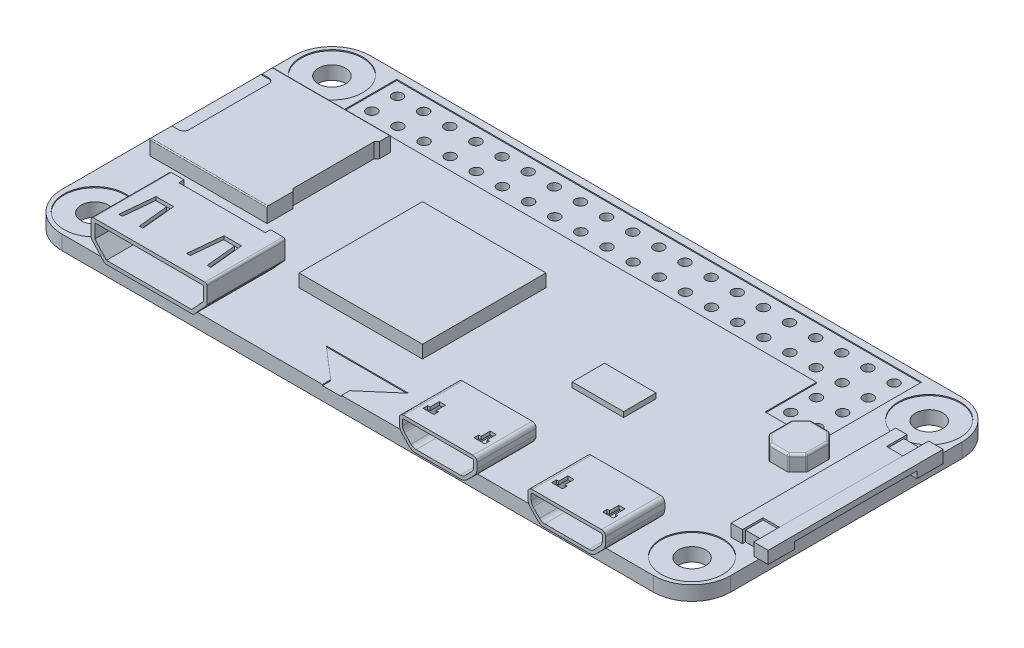
from build123d import *

# Parameters (mm, degrees)
BOSS_EXTRUDE1_DEPTH      = 1.4
SKETCH2_R                = 1.325
CUT_EXTRUDE1_DEPTH       = 36.821920663
SKETCH3_R                = 0.5
CUT_EXTRUDE2_DEPTH       = 36.821920663
LPATTERN1_COUNT          = 20
LPATTERN1_PITCH          = 2.54
SKETCH5_R                = 0.5
CUT_EXTRUDE4_DEPTH       = 36.821920663
SKETCH4_R                = 3
CUT_EXTRUDE3_DEPTH       = 0.1
SKETCH6_W                = 12
SKETCH6_H                = 12
BOSS_EXTRUDE2_DEPTH      = 1.25
BOSS_EXTRUDE3_DEPTH      = 1.45
FILLET2_R                = 0.1
CUT_EXTRUDE5_DEPTH       = 65.240816464
CUT_EXTRUDE5_DEPTH_BACK  = 9.5
SKETCH8_W                = 11.8
SKETCH8_H                = 1.25
BOSS_EXTRUDE4_DEPTH      = 0.4
BOSS_EXTRUDE4_DEPTH_BACK = 7.2
FILLET1_R                = 0.2
CUT_EXTRUDE6_DEPTH       = 7
SKETCH11_W               = 7
SKETCH11_H               = 0.55
BOSS_EXTRUDE5_DEPTH      = 3.5
CUT_EXTRUDE7_DEPTH       = 37.226130072
SKETCH13_W               = 8.4
SKETCH13_H               = 1.4
CUT_EXTRUDE8_DEPTH       = 0.5
BOSS_EXTRUDE6_DEPTH      = 1.25
BOSS_EXTRUDE6_DEPTH_BACK = 4.5
CUT_EXTRUDE9_DEPTH       = 5.25
SKETCH17_W               = 3.15
SKETCH17_H               = 0.4
BOSS_EXTRUDE7_DEPTH      = 3.5
CUT_EXTRUDE10_DEPTH      = 0.32
BOSS_EXTRUDE8_DEPTH      = 0.9
BOSS_EXTRUDE8_DEPTH_BACK = 0.5
BOSS_EXTRUDE9_DEPTH      = 1.19
SKETCH21_W               = 1.6
SKETCH21_H               = 1.7
BOSS_EXTRUDE10_DEPTH     = 1
SKETCH22_W               = 3.65
SKETCH22_H               = 4
BOSS_EXTRUDE11_DEPTH     = 1.5
CHAMFER1_SIZE            = 0.9
SKETCH23_W               = 5
SKETCH23_H               = 3.15
BOSS_EXTRUDE12_DEPTH     = 0.5
FILLET3_R                = 0.2


with BuildPart() as part:
    # Sketch1 → Boss-Extrude1 (new body)
    with BuildSketch(Plane(origin=(0, 0, 0), x_dir=(1, 0, 0), z_dir=(0, 1, 0))):
        with BuildLine():
            Line((-28.75, 15), (28.75, 15))
            ThreePointArc((28.75, 15), (31.401650429, 13.901650429), (32.5, 11.25))
            Line((32.5, 11.25), (32.5, -11.25))
            ThreePointArc((32.5, -11.25), (31.401650429, -13.901650429), (28.75, -15))
            Line((28.75, -15), (-28.75, -15))
            ThreePointArc((-28.75, -15), (-31.401650429, -13.901650429), (-32.5, -11.25))
            Line((-32.5, -11.25), (-32.5, 11.25))
            ThreePointArc((-32.5, 11.25), (-31.401650429, 13.901650429), (-28.75, 15))
        make_face()
    extrude(amount=BOSS_EXTRUDE1_DEPTH)

    # Sketch2 → Cut-Extrude1 (cut, through all)
    with BuildSketch(Plane(origin=(0, 1.4, 0), x_dir=(1, 0, 0), z_dir=(0, 1, 0))):
        with Locations(Location((-29.025, 11.525, 0), (0, 0, 270))):
            Circle(SKETCH2_R)
        with Locations(Location((29.025, 11.525, 0), (0, 0, 90))):
            Circle(SKETCH2_R)
        with Locations(Location((29.025, -11.525, 0), (0, 0, 270))):
            Circle(SKETCH2_R)
        with Locations(Location((-29.025, -11.525, 0), (0, 0, 90))):
            Circle(SKETCH2_R)
    extrude(amount=-CUT_EXTRUDE1_DEPTH, mode=Mode.SUBTRACT)

    # Sketch3 → Cut-Extrude2 (cut, through all)
    with BuildSketch(Plane(origin=(0, 1.4, 0), x_dir=(1, 0, 0), z_dir=(0, 1, 0))):
        with Locations(Location((-24.128, 13, 0), (0, 0, 270))):
            Circle(SKETCH3_R)
        with Locations(Location((-24.128, 10.5, 0), (0, 0, 270))):
            Circle(SKETCH3_R)
    cut_extrude2 = extrude(amount=-CUT_EXTRUDE2_DEPTH, mode=Mode.SUBTRACT)

    # LPattern1: Cut-Extrude2 ×20
    with Locations(*[(i * LPATTERN1_PITCH, 0, 0) for i in range(1, LPATTERN1_COUNT)]):
        add(cut_extrude2, mode=Mode.SUBTRACT)

    # Sketch5 → Cut-Extrude4 (cut, through all)
    with BuildSketch(Plane(origin=(0, 1.4, 0), x_dir=(1, 0, 0), z_dir=(0, 1, 0))):
        with Locations(Location((21.592, 5.5, 0), (0, 0, 270))):
            Circle(SKETCH5_R)
        with Locations(Location((24.132, 5.5, 0), (0, 0, 270))):
            Circle(SKETCH5_R)
        with Locations(Location((21.592, 8, 0), (0, 0, 270))):
            Circle(SKETCH5_R)
        with Locations(Location((24.132, 8, 0), (0, 0, 270))):
            Circle(SKETCH5_R)
    extrude(amount=-CUT_EXTRUDE4_DEPTH, mode=Mode.SUBTRACT)

    # Sketch4 → Cut-Extrude3 (cut)
    with BuildSketch(Plane(origin=(0, 1.4, 0), x_dir=(1, 0, 0), z_dir=(0, 1, 0))):
        with Locations(Location((-29.025, 11.525, 0), (0, 0, 270))):
            Circle(SKETCH4_R)
        with Locations(Location((-29.025, -11.525, 0), (0, 0, 270))):
            Circle(SKETCH4_R)
        with Locations(Location((29.025, -11.525, 0), (0, 0, 270))):
            Circle(SKETCH4_R)
        with Locations(Location((29.025, 11.525, 0), (0, 0, 270))):
            Circle(SKETCH4_R)
        Polygon((-25.5, 14.3), (25.5, 14.3), (25.5, 9.2), (25.5, 4.2), (20.4, 4.2), (20.4, 9.2), (-25.5, 9.2), align=None)
        Polygon((-6.5, -11.55), (1.5, -11.55), (-1.575, -14.2), (-1.575, -15), (-3.425, -15), (-3.425, -14.2), align=None)
    extrude(amount=-CUT_EXTRUDE3_DEPTH, mode=Mode.SUBTRACT)

    # Sketch6 → Boss-Extrude2 (add)
    with BuildSketch(Plane(origin=(0, 1.4, 0), x_dir=(1, 0, 0), z_dir=(0, 1, 0))):
        with Locations((-6.7, -2)):
            Rectangle(SKETCH6_W, SKETCH6_H)
    extrude(amount=BOSS_EXTRUDE2_DEPTH)

    # Sketch7 → Boss-Extrude3 (add)
    with BuildSketch(Plane(origin=(0, 1.4, 0), x_dir=(1, 0, 0), z_dir=(0, 1, 0))):
        with BuildLine():
            Line((-19.65, 7.85), (-19.65, 6.75))
            Line((-19.65, 6.75), (-19.9, 6.5))
            Line((-19.9, 6.5), (-19.9, -1.4))
            Line((-19.9, -1.4), (-19.65, -1.65))
            Line((-19.65, -1.65), (-19.65, -4.15))
            Line((-19.65, -4.15), (-31.05, -4.15))
            Line((-31.05, -4.15), (-31.05, -2))
            Line((-31.05, -2), (-30.4, -2))
            ThreePointArc((-30.4, -2), (-30.046446609, -1.853553391), (-29.9, -1.5))
            Line((-29.9, -1.5), (-29.9, 6.25))
            ThreePointArc((-29.9, 6.25), (-30.046446609, 6.603553391), (-30.4, 6.75))
            Line((-30.4, 6.75), (-31.05, 6.75))
            Line((-31.05, 6.75), (-31.05, 7.85))
            Line((-31.05, 7.85), (-19.65, 7.85))
        make_face()
    extrude(amount=BOSS_EXTRUDE3_DEPTH)

    # Fillet2
    fillet2_edges = [part.edges().sort_by_distance(p)[0] for p in [
        (-25.35, 2.85, 4.15),
        (-25.35, 2.85, -7.85),
    ]]
    fillet(fillet2_edges, radius=FILLET2_R)

    # Sketch8 → Cut-Extrude5 (cut, two sides: drawn at the far end of the back side and taken through both)
    with BuildSketch(Plane.ZY.offset(29.9).offset(-CUT_EXTRUDE5_DEPTH_BACK)):
        with Locations((-1.85, 2.125)):
            Rectangle(SKETCH8_W, SKETCH8_H)
    extrude(amount=CUT_EXTRUDE5_DEPTH + CUT_EXTRUDE5_DEPTH_BACK, mode=Mode.SUBTRACT)

    # Sketch15 → Boss-Extrude6 (add, two sides: drawn at the far end of the back side and taken through both)
    with BuildSketch(Plane.XY.offset(15).offset(-BOSS_EXTRUDE6_DEPTH_BACK)):
        with BuildLine():
            Line((18.2, 4), (24.95, 4))
            ThreePointArc((24.95, 4), (25.232842712, 3.882842712), (25.35, 3.6))
            Line((25.35, 3.6), (25.35, 3.052310288))
            ThreePointArc((25.35, 3.052310288), (25.277735771, 2.679072643), (25.071387321, 2.359778459))
            Line((25.071387321, 2.359778459), (24.445169445, 1.707468172))
            ThreePointArc((24.445169445, 1.707468172), (24.115871509, 1.480072876), (23.723782124, 1.4))
            Line((23.723782124, 1.4), (19.426217876, 1.4))
            ThreePointArc((19.426217876, 1.4), (19.034128491, 1.480072876), (18.704830555, 1.707468172))
            Line((18.704830555, 1.707468172), (18.078612679, 2.359778459))
            ThreePointArc((18.078612679, 2.359778459), (17.872264229, 2.679072643), (17.8, 3.052310288))
            Line((17.8, 3.052310288), (17.8, 3.6))
            ThreePointArc((17.8, 3.6), (17.917157288, 3.882842712), (18.2, 4))
        make_face()
        with BuildLine():
            Line((12.85, 3.6), (12.85, 3.052310288))
            ThreePointArc((12.85, 3.052310288), (12.777735771, 2.679072643), (12.571387321, 2.359778459))
            Line((12.571387321, 2.359778459), (11.945169445, 1.707468172))
            ThreePointArc((11.945169445, 1.707468172), (11.615871509, 1.480072876), (11.223782124, 1.4))
            Line((11.223782124, 1.4), (6.926217876, 1.4))
            ThreePointArc((6.926217876, 1.4), (6.534128491, 1.480072876), (6.204830555, 1.707468172))
            Line((6.204830555, 1.707468172), (5.578612679, 2.359778459))
            ThreePointArc((5.578612679, 2.359778459), (5.372264229, 2.679072643), (5.3, 3.052310288))
            Line((5.3, 3.052310288), (5.3, 3.6))
            ThreePointArc((5.3, 3.6), (5.417157288, 3.882842712), (5.7, 4))
            Line((5.7, 4), (12.45, 4))
            ThreePointArc((12.45, 4), (12.732842712, 3.882842712), (12.85, 3.6))
        make_face()
    extrude(amount=BOSS_EXTRUDE6_DEPTH + BOSS_EXTRUDE6_DEPTH_BACK)

    # Sketch16 → Cut-Extrude9 (cut)
    with BuildSketch(Plane.XY.offset(16.25)):
        with BuildLine():
            Line((12.45, 3.68), (5.7, 3.68))
            ThreePointArc((5.7, 3.68), (5.643431458, 3.656568542), (5.62, 3.6))
            Line((5.62, 3.6), (5.62, 3.052310288))
            ThreePointArc((5.62, 3.052310288), (5.669139676, 2.798508689), (5.809456622, 2.581388644))
            Line((5.809456622, 2.581388644), (6.435674498, 1.929078357))
            ThreePointArc((6.435674498, 1.929078357), (6.659597094, 1.774449555), (6.926217876, 1.72))
            Line((6.926217876, 1.72), (11.223782124, 1.72))
            ThreePointArc((11.223782124, 1.72), (11.490402906, 1.774449555), (11.714325502, 1.929078357))
            Line((11.714325502, 1.929078357), (12.340543378, 2.581388644))
            ThreePointArc((12.340543378, 2.581388644), (12.480860324, 2.798508689), (12.53, 3.052310288))
            Line((12.53, 3.052310288), (12.53, 3.6))
            ThreePointArc((12.53, 3.6), (12.506568542, 3.656568542), (12.45, 3.68))
        make_face()
        with BuildLine():
            Line((24.214325502, 1.929078357), (24.840543378, 2.581388644))
            ThreePointArc((24.840543378, 2.581388644), (24.980860324, 2.798508689), (25.03, 3.052310288))
            Line((25.03, 3.052310288), (25.03, 3.6))
            ThreePointArc((25.03, 3.6), (25.006568542, 3.656568542), (24.95, 3.68))
            Line((24.95, 3.68), (18.2, 3.68))
            ThreePointArc((18.2, 3.68), (18.143431458, 3.656568542), (18.12, 3.6))
            Line((18.12, 3.6), (18.12, 3.052310288))
            ThreePointArc((18.12, 3.052310288), (18.169139676, 2.798508689), (18.309456622, 2.581388644))
            Line((18.309456622, 2.581388644), (18.935674498, 1.929078357))
            ThreePointArc((18.935674498, 1.929078357), (19.159597094, 1.774449555), (19.426217876, 1.72))
            Line((19.426217876, 1.72), (23.723782124, 1.72))
            ThreePointArc((23.723782124, 1.72), (23.990402906, 1.774449555), (24.214325502, 1.929078357))
        make_face()
    extrude(amount=-CUT_EXTRUDE9_DEPTH, mode=Mode.SUBTRACT)

    # Sketch17 → Boss-Extrude7 (add)
    with BuildSketch(Plane.XY.offset(11)):
        with Locations((9.075, 3.12)):
            Rectangle(SKETCH17_W, SKETCH17_H)
        with Locations((21.575, 3.12)):
            Rectangle(SKETCH17_W, SKETCH17_H)
    extrude(amount=BOSS_EXTRUDE7_DEPTH)

    # Sketch18 → Cut-Extrude10 (cut)
    with BuildSketch(Plane(origin=(0, 4, 0), x_dir=(1, 0, 0), z_dir=(0, 1, 0))):
        Polygon((6.9, -13.37), (6.3, -13.37), (6.3, -14.27), (6.075, -14.27), (6.075, -14.72), (7.125, -14.72), (7.125, -14.27), (6.9, -14.27), align=None)
        Polygon((11.25, -13.37), (11.25, -14.27), (11.025, -14.27), (11.025, -14.72), (12.075, -14.72), (12.075, -14.27), (11.85, -14.27), (11.85, -13.37), align=None)
        Polygon((19.4, -13.37), (18.8, -13.37), (18.8, -14.27), (18.575, -14.27), (18.575, -14.72), (19.625, -14.72), (19.625, -14.27), (19.4, -14.27), align=None)
        Polygon((23.75, -13.37), (23.75, -14.27), (23.525, -14.27), (23.525, -14.72), (24.575, -14.72), (24.575, -14.27), (24.35, -14.27), (24.35, -13.37), align=None)
    extrude(amount=-CUT_EXTRUDE10_DEPTH, mode=Mode.SUBTRACT)

    # Sketch19 → Boss-Extrude8 (add, two sides: drawn at the far end of the back side and taken through both)
    with BuildSketch(Plane(origin=(32.5, 0, 0), x_dir=(0, 0, -1), z_dir=(1, 0, 0)).offset(-BOSS_EXTRUDE8_DEPTH_BACK)):
        Polygon((-8.5, 2.6), (8.5, 2.6), (8.5, 1.4), (5.95, 1.4), (5.95, 2.05), (-5.95, 2.05), (-5.95, 1.4), (-8.5, 1.4), align=None)
    extrude(amount=BOSS_EXTRUDE8_DEPTH + BOSS_EXTRUDE8_DEPTH_BACK)

    # Sketch20 → Boss-Extrude9 (add)
    with BuildSketch(Plane(origin=(0, 1.4, 0), x_dir=(1, 0, 0), z_dir=(0, 1, 0))):
        Polygon((32, 6), (30.4, 6), (30.4, 8), (29.3, 8), (29.3, -8), (30.4, -8), (30.4, -6), (32, -6), align=None)
    extrude(amount=BOSS_EXTRUDE9_DEPTH)

    # Sketch21 → Boss-Extrude10 (add)
    with BuildSketch(Plane(origin=(0, 1.4, 0), x_dir=(1, 0, 0), z_dir=(0, 1, 0))):
        with Locations((31.2, 6.85)):
            Rectangle(SKETCH21_W, SKETCH21_H)
        with Locations((31.2, -6.85)):
            Rectangle(SKETCH21_W, SKETCH21_H)
    extrude(amount=BOSS_EXTRUDE10_DEPTH)

    # Sketch22 → Boss-Extrude11 (add)
    with BuildSketch(Plane(origin=(0, 1.4, 0), x_dir=(1, 0, 0), z_dir=(0, 1, 0))):
        with Locations((25.675, 2.25)):
            Rectangle(SKETCH22_W, SKETCH22_H)
    extrude(amount=BOSS_EXTRUDE11_DEPTH)

    # Chamfer1
    # the kernel refuses this chamfer: 0.9 mm, written as the material it takes off along each edge
    with BuildSketch(Plane(origin=(23.85, 1.4, -4.25), x_dir=(0.9996219169112966, 0, -0.027495876610586487), z_dir=(0, 1, 0))) as chamfer1_piece_1:
        Polygon((CHAMFER1_SIZE * 0.999621916911, -CHAMFER1_SIZE * 0.0274958766106), (-CHAMFER1_SIZE * 0.0274958766106, -CHAMFER1_SIZE * 0.999621916911), (0, 0), align=None)
    extrude(amount=3.814514689, mode=Mode.SUBTRACT)
    with BuildSketch(Plane(origin=(23.85, 1.4, -0.25), x_dir=(0.9996219169112966, 0, 0.027495876610586487), z_dir=(0, 1, 0)), Plane(origin=(27.5, 1.4, -0.25), x_dir=(0.027495876610584467, 0, -0.9996219169112966), z_dir=(0, 1, 0)), Plane(origin=(27.5, 1.4, -4.25), x_dir=(-0.9996219169112966, 0, -0.027495876610586487), z_dir=(0, 1, 0))) as chamfer1_piece_2:
        Polygon((CHAMFER1_SIZE * 0.999621916911, CHAMFER1_SIZE * 0.0274958766106), (-CHAMFER1_SIZE * 0.0274958766106, CHAMFER1_SIZE * 0.999621916911), (0, 0), align=None)
    extrude(amount=3.814514689, mode=Mode.SUBTRACT)

    # Sketch23 → Boss-Extrude12 (add)
    with BuildSketch(Plane(origin=(0, 1.4, 0), x_dir=(1, 0, 0), z_dir=(0, 1, 0))):
        with Locations((11.5, -1.575)):
            Rectangle(SKETCH23_W, SKETCH23_H)
    extrude(amount=BOSS_EXTRUDE12_DEPTH)

    # Fillet3
    # the kernel refuses this fillet: 0.2 mm, written as the material it takes off along each edge
    with BuildSketch(Plane(origin=(24.05, 2.7, -1.232842712), x_dir=(-1, 0, 0), z_dir=(0, 1, 0))) as fillet3_piece_1_section:
        Polygon((0, 0), (FILLET3_R, 0), (FILLET3_R, FILLET3_R * 0.414213562373), (FILLET3_R * 0.707106781187, FILLET3_R * 0.707106781186), align=None)
    fillet3_piece_1 = extrude(amount=FILLET3_R, mode=Mode.PRIVATE)
    fillet3_piece_1 = fillet3_piece_1 - Plane(origin=(24.05, 2.7, -1.232842712), x_dir=(0.9238795325113632, 0, -0.38268343236490504), z_dir=(0, 1, 0)) * Sphere(FILLET3_R, mode=Mode.PRIVATE)
    add(fillet3_piece_1, mode=Mode.SUBTRACT)
    with BuildSketch(Plane(origin=(24.05, 2.7, -3.267157288), x_dir=(-0.7071067811868302, 0, -0.7071067811862648), z_dir=(0, 1, 0))) as fillet3_piece_2_section:
        Polygon((0, 0), (FILLET3_R, 0), (FILLET3_R, FILLET3_R * 0.414213562373), (FILLET3_R * 0.707106781187, FILLET3_R * 0.707106781186), align=None)
    fillet3_piece_2 = extrude(amount=FILLET3_R, mode=Mode.PRIVATE)
    fillet3_piece_2 = fillet3_piece_2 - Plane(origin=(24.05, 2.7, -3.267157288), x_dir=(0.9238795325113632, 0, 0.38268343236490504), z_dir=(0, 1, 0)) * Sphere(FILLET3_R, mode=Mode.PRIVATE)
    add(fillet3_piece_2, mode=Mode.SUBTRACT)
    with BuildSketch(Plane(origin=(24.832842712, 2.7, -4.05), x_dir=(0, 0, -1), z_dir=(0, 1, 0))) as fillet3_piece_3_section:
        Polygon((0, 0), (FILLET3_R, 0), (FILLET3_R, FILLET3_R * 0.414213562373), (FILLET3_R * 0.707106781186, FILLET3_R * 0.707106781187), align=None)
    fillet3_piece_3 = extrude(amount=FILLET3_R, mode=Mode.PRIVATE)
    fillet3_piece_3 = fillet3_piece_3 - Plane(origin=(24.832842712, 2.7, -4.05), x_dir=(0.38268343236527447, 0, 0.9238795325112102), z_dir=(0, 1, 0)) * Sphere(FILLET3_R, mode=Mode.PRIVATE)
    add(fillet3_piece_3, mode=Mode.SUBTRACT)
    with BuildSketch(Plane(origin=(26.517157288, 2.7, -4.05), x_dir=(0, 0, -1), z_dir=(0, 1, 0))) as fillet3_piece_4_section:
        Polygon((0, 0), (FILLET3_R, 0), (FILLET3_R, -FILLET3_R * 0.414213562373), (FILLET3_R * 0.707106781186, -FILLET3_R * 0.707106781187), align=None)
    fillet3_piece_4 = extrude(amount=FILLET3_R, mode=Mode.PRIVATE)
    fillet3_piece_4 = fillet3_piece_4 - Plane(origin=(26.517157288, 2.7, -4.05), x_dir=(-0.38268343236527447, 0, 0.9238795325112102), z_dir=(0, 1, 0)) * Sphere(FILLET3_R, mode=Mode.PRIVATE)
    add(fillet3_piece_4, mode=Mode.SUBTRACT)
    with BuildSketch(Plane(origin=(26.517157288, 2.7, -0.45), x_dir=(0, 0, 1), z_dir=(0, 1, 0))) as fillet3_piece_5_section:
        Polygon((0, 0), (FILLET3_R, 0), (FILLET3_R, FILLET3_R * 0.414213562373), (FILLET3_R * 0.707106781187, FILLET3_R * 0.707106781186), align=None)
    fillet3_piece_5 = extrude(amount=FILLET3_R, mode=Mode.PRIVATE)
    fillet3_piece_5 = fillet3_piece_5 - Plane(origin=(26.517157288, 2.7, -0.45), x_dir=(-0.3826834323649051, 0, -0.9238795325113633), z_dir=(0, 1, 0)) * Sphere(FILLET3_R, mode=Mode.PRIVATE)
    add(fillet3_piece_5, mode=Mode.SUBTRACT)
    with BuildSketch(Plane(origin=(24.832842712, 2.7, -0.45), x_dir=(0, 0, 1), z_dir=(0, 1, 0))) as fillet3_piece_6_section:
        Polygon((0, 0), (FILLET3_R, 0), (FILLET3_R, -FILLET3_R * 0.414213562373), (FILLET3_R * 0.707106781186, -FILLET3_R * 0.707106781187), align=None)
    fillet3_piece_6 = extrude(amount=FILLET3_R, mode=Mode.PRIVATE)
    fillet3_piece_6 = fillet3_piece_6 - Plane(origin=(24.832842712, 2.7, -0.45), x_dir=(0.38268343236527447, 0, -0.9238795325112102), z_dir=(0, 1, 0)) * Sphere(FILLET3_R, mode=Mode.PRIVATE)
    add(fillet3_piece_6, mode=Mode.SUBTRACT)
    with BuildSketch(Plane(origin=(27.3, 2.7, -3.267157288), x_dir=(0.7071067811868302, 0, -0.7071067811862648), z_dir=(0, 1, 0))) as fillet3_piece_7_section:
        Polygon((0, 0), (FILLET3_R, 0), (FILLET3_R, -FILLET3_R * 0.414213562373), (FILLET3_R * 0.707106781187, -FILLET3_R * 0.707106781186), align=None)
    fillet3_piece_7 = extrude(amount=FILLET3_R, mode=Mode.PRIVATE)
    fillet3_piece_7 = fillet3_piece_7 - Plane(origin=(27.3, 2.7, -3.267157288), x_dir=(-0.9238795325113632, 0, 0.38268343236490504), z_dir=(0, 1, 0)) * Sphere(FILLET3_R, mode=Mode.PRIVATE)
    add(fillet3_piece_7, mode=Mode.SUBTRACT)
    with BuildSketch(Plane(origin=(27.3, 2.7, -1.232842712), x_dir=(1, 0, 0), z_dir=(0, 1, 0))) as fillet3_piece_8_section:
        Polygon((0, 0), (FILLET3_R, 0), (FILLET3_R, -FILLET3_R * 0.414213562373), (FILLET3_R * 0.707106781186, -FILLET3_R * 0.707106781187), align=None)
    fillet3_piece_8 = extrude(amount=FILLET3_R, mode=Mode.PRIVATE)
    fillet3_piece_8 = fillet3_piece_8 - Plane(origin=(27.3, 2.7, -1.232842712), x_dir=(-0.9238795325112102, 0, -0.38268343236527447), z_dir=(0, 1, 0)) * Sphere(FILLET3_R, mode=Mode.PRIVATE)
    add(fillet3_piece_8, mode=Mode.SUBTRACT)
    with BuildSketch(Plane(origin=(23.85, 2.9, -1.232842712), x_dir=(0, -1, 0), z_dir=(0, 0, -1)), Plane(origin=(27.5, 2.9, -3.267157288), x_dir=(0, -1, 0), z_dir=(0, 0, 1))) as fillet3_piece_9:
        with BuildLine():
            CenterArc((FILLET3_R, -FILLET3_R), FILLET3_R, 90, 90)
            Line((0, -FILLET3_R), (0, 0))
            Line((0, 0), (FILLET3_R, 0))
        make_face()
    extrude(amount=2.034314575, mode=Mode.SUBTRACT)
    with BuildSketch(Plane(origin=(23.85, 1.4, -1.15), x_dir=(-4.331389821029687e-12, 0, -1.0), z_dir=(0, 1, 0)), Plane(origin=(23.85, 1.4, -3.35), x_dir=(0.7071067811862634, 0, -0.7071067811868317), z_dir=(0, 1, 0)), Plane(origin=(24.75, 1.4, -4.25), x_dir=(1.0, 0, 4.299226035225122e-12), z_dir=(0, 1, 0))) as fillet3_piece_10:
        with BuildLine():
            CenterArc((FILLET3_R * 0.414213562369, -FILLET3_R), FILLET3_R, 90, 45)
            Line((-FILLET3_R * 0.292893218816, -FILLET3_R * 0.292893218811), (0, 0))
            Line((0, 0), (FILLET3_R * 0.414213562373, 0))
        make_face()
    extrude(amount=1.3, mode=Mode.SUBTRACT)
    with BuildSketch(Plane(origin=(24.832842712, 2.9, -4.25), x_dir=(0, -1, 0), z_dir=(1, 0, 0)), Plane(origin=(26.517157288, 2.9, -0.25), x_dir=(0, -1, 0), z_dir=(-1, 0, 0))) as fillet3_piece_11:
        with BuildLine():
            CenterArc((FILLET3_R, -FILLET3_R), FILLET3_R, 90, 90)
            Line((0, -FILLET3_R), (0, 0))
            Line((0, 0), (FILLET3_R, 0))
        make_face()
    extrude(amount=1.684314575, mode=Mode.SUBTRACT)
    with BuildSketch(Plane(origin=(26.6, 1.4, -4.25), x_dir=(-1.0, 0, 4.299226035225122e-12), z_dir=(0, 1, 0)), Plane(origin=(27.5, 1.4, -1.15), x_dir=(-4.331389821024788e-12, 0, -1.0), z_dir=(0, 1, 0)), Plane(origin=(27.5, 1.4, -3.35), x_dir=(-0.7071067811862634, 0, -0.7071067811868317), z_dir=(0, 1, 0)), Plane(origin=(24.75, 1.4, -0.25), x_dir=(1.0, 0, -4.38801148560968e-12), z_dir=(0, 1, 0)), Plane(origin=(26.6, 1.4, -0.25), x_dir=(0.7071067811868266, 0, -0.7071067811862685), z_dir=(0, 1, 0))) as fillet3_piece_12:
        with BuildLine():
            CenterArc((FILLET3_R * 0.414213562378, FILLET3_R), FILLET3_R, 225, 45)
            Line((-FILLET3_R * 0.292893218811, FILLET3_R * 0.292893218816), (0, 0))
            Line((0, 0), (FILLET3_R * 0.414213562373, 0))
        make_face()
    extrude(amount=1.3, mode=Mode.SUBTRACT)
    with BuildSketch(Plane(origin=(24.691421356, 2.9, -0.308578644), x_dir=(0, -1, 0), z_dir=(-0.7071067811862648, 0, -0.7071067811868302)), Plane(origin=(27.441421356, 2.9, -1.091421356), x_dir=(0, -1, 0), z_dir=(-0.7071067811868302, 0, 0.7071067811862648)), Plane(origin=(26.658578644, 2.9, -4.191421356), x_dir=(0, -1, 0), z_dir=(0.7071067811862648, 0, 0.7071067811868302))) as fillet3_piece_13:
        with BuildLine():
            CenterArc((FILLET3_R, -FILLET3_R), FILLET3_R, 90, 90)
            Line((0, -FILLET3_R), (0, 0))
            Line((0, 0), (FILLET3_R, 0))
        make_face()
    extrude(amount=1.107106781, mode=Mode.SUBTRACT)
    with BuildSketch(Plane(origin=(24.691421356, 2.9, -4.191421356), x_dir=(0, -1, 0), z_dir=(-0.7071067811862648, 0, 0.7071067811868302))) as fillet3_piece_14:
        with BuildLine():
            CenterArc((FILLET3_R, FILLET3_R), FILLET3_R, 180, 90)
            Line((0, FILLET3_R), (0, 0))
            Line((0, 0), (FILLET3_R, 0))
        make_face()
    extrude(amount=1.107106781, mode=Mode.SUBTRACT)


with BuildPart() as body_2:
    # Sketch9 → Boss-Extrude4 (new, two sides: drawn at the far end of the back side and taken through both)
    with BuildSketch(Plane.XY.offset(15).offset(-BOSS_EXTRUDE4_DEPTH_BACK)):
        Polygon((-25.5, 4.7), (-14.25, 4.7), (-14.25, 2.85), (-15.575, 1.4), (-24.175, 1.4), (-25.5, 2.85), align=None)
    extrude(amount=BOSS_EXTRUDE4_DEPTH + BOSS_EXTRUDE4_DEPTH_BACK)

    # Fillet1
    fillet1_edges = [body_2.edges().sort_by_distance(p)[0] for p in [
        (-25.5, 4.7, 11.6),
        (-14.25, 4.7, 11.6),
        (-14.25, 2.85, 11.6),
        (-15.575, 1.4, 11.6),
        (-24.175, 1.4, 11.6),
        (-25.5, 2.85, 11.6),
    ]]
    fillet(fillet1_edges, radius=FILLET1_R)

    # Sketch10 → Cut-Extrude6 (cut)
    with BuildSketch(Plane.XY.offset(15.4)):
        Polygon((-25.15, 4.35), (-25.15, 2.985829331), (-24.020707681, 1.75), (-15.729292319, 1.75), (-14.6, 2.985829331), (-14.6, 4.35), align=None)
    extrude(amount=-CUT_EXTRUDE6_DEPTH, mode=Mode.SUBTRACT)

    # Sketch11 → Boss-Extrude5 (add)
    with BuildSketch(Plane.XY.offset(8.4)):
        with Locations((-19.875, 3.225)):
            Rectangle(SKETCH11_W, SKETCH11_H)
    extrude(amount=BOSS_EXTRUDE5_DEPTH)

    # Sketch12 → Cut-Extrude7 (cut, through all)
    with BuildSketch(Plane.XZ.offset(-4.35)):
        Polygon((-24.025, 10.57), (-22.325, 10.57), (-22, 13.87), (-22.351693275, 13.87), (-22.642223578, 10.92), (-23.707776422, 10.92), (-23.998306725, 13.87), (-24.35, 13.87), align=None)
        Polygon((-15.725, 10.57), (-15.4, 13.87), (-15.751693275, 13.87), (-16.042223578, 10.92), (-17.107776422, 10.92), (-17.398306725, 13.87), (-17.75, 13.87), (-17.425, 10.57), align=None)
    extrude(amount=-CUT_EXTRUDE7_DEPTH, mode=Mode.SUBTRACT)

    # Sketch13 → Cut-Extrude8 (cut)
    with BuildSketch(Plane(origin=(0, 0, 7.8), x_dir=(-1, 0, 0), z_dir=(0, 0, -1))):
        with Locations((19.875, 4)):
            Rectangle(SKETCH13_W, SKETCH13_H)
    extrude(amount=-CUT_EXTRUDE8_DEPTH, mode=Mode.SUBTRACT)


solid = Compound([part.part, body_2.part])
